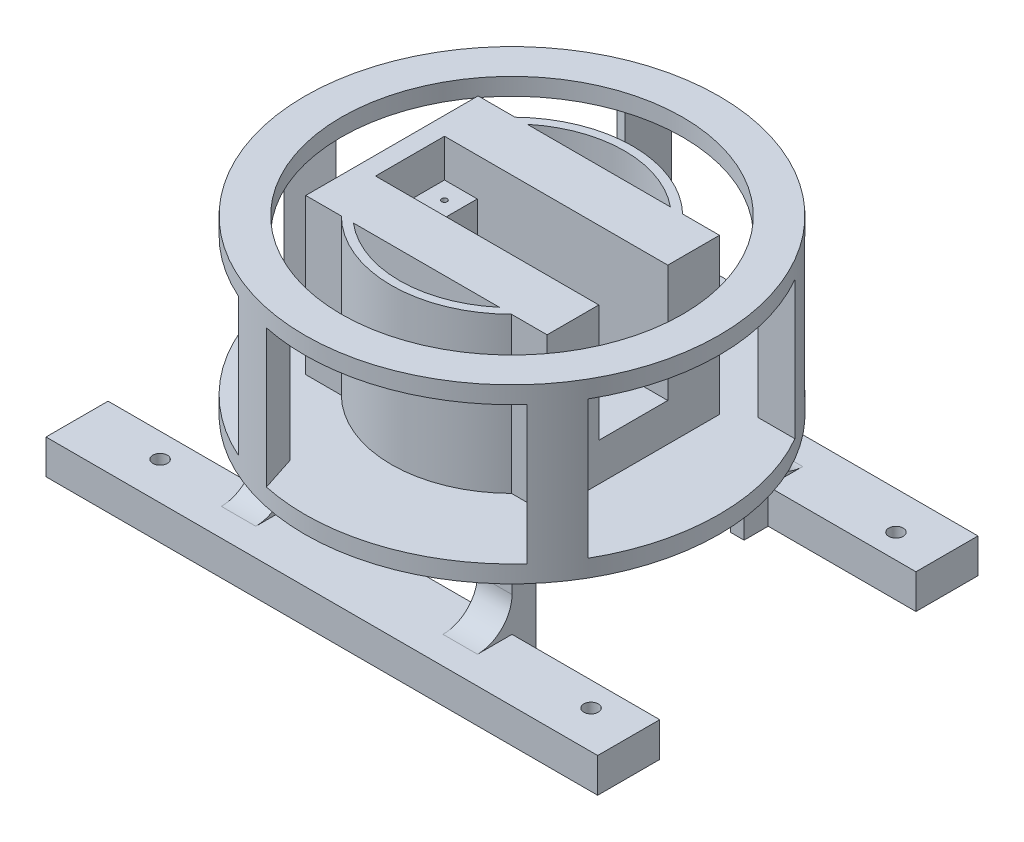
from build123d import *

# Parameters (mm, degrees)
ESQUISSE1_W                  = 70
ESQUISSE1_H                  = 50
BOSS_EXTRU_1_DEPTH           = 50
ESQUISSE2_W                  = 40.5
ESQUISSE2_H                  = 20
ENL_V_MAT_EXTRU_1_DEPTH      = 38
ESQUISSE3_W                  = 9.502474521
ESQUISSE3_H                  = 20
ENL_V_MAT_EXTRU_2_DEPTH      = 11
ESQUISSE4_R                  = 60.076490873
ESQUISSE4_R_2                = 49.5
BOSS_EXTRU_2_DEPTH           = 50
ESQUISSE5_W                  = 60
ESQUISSE5_H                  = 40
ENL_V_MAT_EXTRU_3_DEPTH      = 24
R_P_TITION_START             = -20
R_P_TITION_CIRCULAIRE1_DEPTH = 40
ESQUISSE12_W                 = 74.3
ESQUISSE12_H                 = 74.3
BOSS_EXTRU_7_DEPTH           = 28
ESQUISSE13_W                 = 160
ESQUISSE13_H                 = 18
BOSS_EXTRU_8_DEPTH           = 10
ESQUISSE15_R                 = 60.076490873
BOSS_EXTRU_9_DEPTH           = 5
ESQUISSE16_W                 = 60
ESQUISSE16_H                 = 70
ENL_V_MAT_EXTRU_4_DEPTH      = 28
ENL_V_MAT_EXTRU_5_REACH      = 156.276
ESQUISSE17_W                 = 60.3
ESQUISSE17_H                 = 28
ENL_V_MAT_EXTRU_6_REACH      = 138.609
ESQUISSE18_W                 = 54.3
ESQUISSE18_H                 = 15.510808694
TROU_TARAUD_M5X0_82_D        = 4.2
TROU_TARAUD_M5X0_82_DEPTH    = 54.927
TROU_TARAUD_M5X0_82_TIP      = 1.2618073
TROU_TARAUD_M5X0_83_D        = 4.2
TROU_TARAUD_M5X0_83_DEPTH    = 54.927
TROU_TARAUD_M5X0_83_TIP      = 1.2618073
CONG_1_R                     = 10
ESQUISSE25_W                 = 16.470730929
ESQUISSE25_H                 = 20
ENL_V_MAT_EXTRU_7_DEPTH      = 34
TROU_TARAUD_M2X0_41_D        = 1.6
TROU_TARAUD_M2X0_41_DEPTH    = 15
TROU_TARAUD_M2X0_41_TIP      = 0.480688495


# Read off the part's stored shape, not the designer's step: Répétition circulaire1
with BuildPart() as part:
    # Esquisse1 → Boss.-Extru.1 (new body)
    with BuildSketch(Plane.XY):
        Rectangle(ESQUISSE1_W, ESQUISSE1_H)
    extrude(amount=BOSS_EXTRU_1_DEPTH)

    # Esquisse2 → Enlèv. mat.-Extru.1 (cut)
    with BuildSketch(Plane(origin=(0, 25, 0), x_dir=(1, 0, 0), z_dir=(0, 1, 0))):
        with Locations((0, -25)):
            Rectangle(ESQUISSE2_W, ESQUISSE2_H)
    extrude(amount=-ENL_V_MAT_EXTRU_1_DEPTH, mode=Mode.SUBTRACT)

    # Esquisse3 → Enlèv. mat.-Extru.2 (cut)
    with BuildSketch(Plane(origin=(0, 25, 0), x_dir=(1, 0, 0), z_dir=(0, 1, 0))):
        with Locations((25.001237261, -25)):
            Rectangle(ESQUISSE3_W, ESQUISSE3_H)
        with Locations((-25.001237261, -25)):
            Rectangle(ESQUISSE3_W, ESQUISSE3_H)
    extrude(amount=-ENL_V_MAT_EXTRU_2_DEPTH, mode=Mode.SUBTRACT)

    # Esquisse4 → Boss.-Extru.2 (add)
    # profile 1 of 7: a face of its own
    with BuildSketch(Plane(origin=(0, 25, 0), x_dir=(1, 0, 0), z_dir=(0, 1, 0))):
        with Locations(Location((0, -25.176679726, 0), (0, 0, 270))):
            Circle(ESQUISSE4_R)
        with Locations(Location((0, -25.176679726, 0), (0, 0, 270))):
            Circle(ESQUISSE4_R_2, mode=Mode.SUBTRACT)
    # profile 2 of 7: a face of its own
    with BuildSketch(Plane(origin=(0, 25, 0), x_dir=(1, 0, 0), z_dir=(0, 1, 0))):
        with BuildLine():
            ThreePointArc((24.673928965, -50), (32.315534297, -38.619381951), (35, -25.176679726))
            ThreePointArc((35, -25.176679726), (32.217729855, -11.501231543), (24.313263828, 0))
            Line((24.313263828, 0), (20.744399349, 0))
            ThreePointArc((20.744399349, 0), (29.503552635, -11.257782921), (32.622006474, -25.176679726))
            ThreePointArc((32.622006474, -25.176679726), (29.619854452, -38.846336948), (21.16596506, -50))
            Line((21.16596506, -50), (24.673928965, -50))
        make_face()
    # profile 3 of 7: a face of its own
    with BuildSketch(Plane(origin=(0, 25, 0), x_dir=(1, 0, 0), z_dir=(0, 1, 0))):
        with BuildLine():
            Line((-20.744399349, 0), (-24.313263828, 0))
            ThreePointArc((-24.313263828, 0), (-34.99908948, -24.924220698), (-24.673928965, -50))
            Line((-24.673928965, -50), (-21.16596506, -50))
            ThreePointArc((-21.16596506, -50), (-32.620847034, -24.901643114), (-20.744399349, 0))
        make_face()
    # profile 4 of 7: a face of its own
    with BuildSketch(Plane(origin=(0, 25, 0), x_dir=(1, 0, 0), z_dir=(0, 1, 0))):
        with BuildLine():
            Line((20.744399349, 0), (24.313263828, 0))
            ThreePointArc((24.313263828, 0), (0, 9.823320274), (-24.313263828, 0))
            Line((-24.313263828, 0), (-20.744399349, 0))
            ThreePointArc((-20.744399349, 0), (0, 7.445326748), (20.744399349, 0))
        make_face()
    # profile 5 of 7: a face of its own
    with BuildSketch(Plane(origin=(0, 25, 0), x_dir=(1, 0, 0), z_dir=(0, 1, 0))):
        with BuildLine():
            ThreePointArc((24.673928965, -50), (32.315534297, -38.619381951), (35, -25.176679726))
            ThreePointArc((35, -25.176679726), (32.217729855, -11.501231543), (24.313263828, 0))
            Line((24.313263828, 0), (20.744399349, 0))
            ThreePointArc((20.744399349, 0), (29.503552635, -11.257782921), (32.622006474, -25.176679726))
            ThreePointArc((32.622006474, -25.176679726), (29.619854452, -38.846336948), (21.16596506, -50))
            Line((21.16596506, -50), (24.673928965, -50))
        make_face()
    # profile 6 of 7: a face of its own
    with BuildSketch(Plane(origin=(0, 25, 0), x_dir=(1, 0, 0), z_dir=(0, 1, 0))):
        with BuildLine():
            Line((-20.744399349, 0), (-24.313263828, 0))
            ThreePointArc((-24.313263828, 0), (-34.99908948, -24.924220698), (-24.673928965, -50))
            Line((-24.673928965, -50), (-21.16596506, -50))
            ThreePointArc((-21.16596506, -50), (-32.620847034, -24.901643114), (-20.744399349, 0))
        make_face()
    # profile 7 of 7: a face of its own
    with BuildSketch(Plane(origin=(0, 25, 0), x_dir=(1, 0, 0), z_dir=(0, 1, 0))):
        with BuildLine():
            ThreePointArc((-24.673928965, -50), (0, -60.176679726), (24.673928965, -50))
            Line((24.673928965, -50), (21.16596506, -50))
            ThreePointArc((21.16596506, -50), (0, -57.798686199), (-21.16596506, -50))
            Line((-21.16596506, -50), (-24.673928965, -50))
        make_face()
    extrude(amount=-BOSS_EXTRU_2_DEPTH)


with BuildPart() as boss_extru_2_piece_1:
    # of the separate pieces the step leaves, piece 1, a body of its own (boss_extru_2_pieces)
    add(part.part.solids().sort_by_distance((0, 25, 85.253170599))[0])

    # Esquisse5 → Enlèv. mat.-Extru.3 (cut)
    with BuildSketch(Plane(origin=(60.076490873, 0, 0), x_dir=(0, 0, -1), z_dir=(1, 0, 0))):
        with Locations((-25.176679726, 0)):
            Rectangle(ESQUISSE5_W, ESQUISSE5_H)
    extrude(amount=-ENL_V_MAT_EXTRU_3_DEPTH, mode=Mode.SUBTRACT)

    # Répétition circulaire1 outline → Répétition circulaire1 (cut)
    with BuildSketch(Plane(origin=(0, 0, 0), x_dir=(1, 0, 0), z_dir=(0, 1, 0)).offset(R_P_TITION_START)):
        with BuildLine():
            Line((39.373214245, 4.823320274), (41.291457614, 4.823320274))
            Line((41.291457614, 4.823320274), (44.615977372, 15.055140003))
            ThreePointArc((44.615977372, 15.055140003), (18.564656642, 31.959458395), (-12.447413605, 33.596159666))
            Line((-12.447413605, 33.596159666), (-15.771933364, 23.364339937))
            Line((-15.771933364, 23.364339937), (-24.475639087, 29.687952296))
            ThreePointArc((-24.475639087, 29.687952296), (-48.602902078, 10.135395619), (-59.742754225, -18.853067366))
            Line((-59.742754225, -18.853067366), (-51.039048501, -25.176679726))
            Line((-51.039048501, -25.176679726), (-59.742754225, -31.500292085))
            ThreePointArc((-59.742754225, -31.500292085), (-48.602902079, -60.488755071), (-24.475639087, -80.041311748))
            Line((-24.475639087, -80.041311748), (-15.771933364, -73.717699388))
            Line((-15.771933364, -73.717699388), (-12.447413605, -83.949519118))
            ThreePointArc((-12.447413605, -83.949519118), (18.564656643, -82.312817847), (44.615977373, -65.408499455))
            Line((44.615977373, -65.408499455), (41.291457614, -55.176679726))
            Line((41.291457614, -55.176679726), (39.373214245, -55.176679726))
            ThreePointArc((39.373214245, -55.176679726), (-49.5, -25.176679726), (39.373214245, 4.823320274))
        make_face()
    extrude(amount=R_P_TITION_CIRCULAIRE1_DEPTH, mode=Mode.SUBTRACT)



with BuildPart() as boss_extru_2_piece_2:
    # of the separate pieces the step leaves, piece 2, a body of its own (boss_extru_2_pieces)
    add(part.part.solids().sort_by_distance((-35, 25, 0))[0])


with BuildPart() as boss_extru_2_piece_1_1:
    add(boss_extru_2_piece_1.part)

    add(boss_extru_2_piece_2.part)  # Boss.-Extru.7 merges Boss.-Extru.2 piece 2
    # Esquisse12 → Boss.-Extru.7 (add)
    with BuildSketch(Plane.XZ.offset(25)):
        with Locations((0, 25.176679726)):
            Rectangle(ESQUISSE12_W, ESQUISSE12_H)
    extrude(amount=BOSS_EXTRU_7_DEPTH)

    # Esquisse13 → Boss.-Extru.8 (add)
    with BuildSketch(Plane.XZ.offset(53)):
        with Locations((0, 71.326679726)):
            Rectangle(ESQUISSE13_W, ESQUISSE13_H)
        with Locations((0, -20.973320274)):
            Rectangle(ESQUISSE13_W, ESQUISSE13_H)
    extrude(amount=-BOSS_EXTRU_8_DEPTH)

    # Esquisse15 → Boss.-Extru.9 (add)
    with BuildSketch(Plane(origin=(0, -20, 0), x_dir=(1, 0, 0), z_dir=(0, 1, 0))):
        with Locations(Location((0, -25.176679726, 0), (0, 0, 270))):
            Circle(ESQUISSE15_R)
    extrude(amount=-BOSS_EXTRU_9_DEPTH)

    # Esquisse16 → Enlèv. mat.-Extru.4 (cut)
    with BuildSketch(Plane.XZ.offset(53)):
        with Locations((3.15, 25.176679726)):
            Rectangle(ESQUISSE16_W, ESQUISSE16_H)
    extrude(amount=-ENL_V_MAT_EXTRU_4_DEPTH, mode=Mode.SUBTRACT)

    # Enlèv. mat.-Extru.5: up to this face of the body (flat: up to its plane)
    enl_v_mat_extru_5_end = Plane(boss_extru_2_piece_1_1.part.faces().sort_by_distance((-37.15, -39, 25.176679726))[0])
    # Esquisse17 → Enlèv. mat.-Extru.5 (cut, up to the picked face)
    with BuildSketch(Plane(origin=(37.15, 0, 0), x_dir=(0, 0, -1), z_dir=(1, 0, 0)), mode=Mode.PRIVATE) as enl_v_mat_extru_5_sk1:
        with Locations((-25.176679726, -39)):
            Rectangle(ESQUISSE17_W, ESQUISSE17_H)
    enl_v_mat_extru_5_tool1 = split(extrude(enl_v_mat_extru_5_sk1.sketch, amount=-ENL_V_MAT_EXTRU_5_REACH, mode=Mode.PRIVATE), bisect_by=enl_v_mat_extru_5_end, keep=Keep.BOTH, mode=Mode.PRIVATE)
    add(enl_v_mat_extru_5_tool1.solids().sort_by(Axis((37.15, -39, 25.17668), (-1, 0, 0)))[0], mode=Mode.SUBTRACT)

    # Enlèv. mat.-Extru.6: up to this face of the body (flat: up to its plane)
    enl_v_mat_extru_6_end = Plane(boss_extru_2_piece_1_1.part.faces().sort_by_distance((0, -34, -11.973320274))[0])
    # Esquisse18 → Enlèv. mat.-Extru.6 (cut, up to the picked face)
    with BuildSketch(Plane.XY.offset(62.326679726), mode=Mode.PRIVATE) as enl_v_mat_extru_6_sk1:
        with Locations((0, -35.244595653)):
            Rectangle(ESQUISSE18_W, ESQUISSE18_H)
    enl_v_mat_extru_6_tool1 = split(extrude(enl_v_mat_extru_6_sk1.sketch, amount=-ENL_V_MAT_EXTRU_6_REACH, mode=Mode.PRIVATE), bisect_by=enl_v_mat_extru_6_end, keep=Keep.BOTH, mode=Mode.PRIVATE)
    add(enl_v_mat_extru_6_tool1.solids().sort_by(Axis((0, -35.244596, 62.32668), (0, 0, -1)))[0], mode=Mode.SUBTRACT)

    # Trou taraudé M5x0.82
    with Locations(Plane(origin=(-57.931903984, -53, -18.999181229), x_dir=(0, 0, -1), z_dir=(0, -1, 0))):
        with Locations((0, 0), (-88.38422, 0.087735642)):
            Hole(TROU_TARAUD_M5X0_82_D / 2, depth=TROU_TARAUD_M5X0_82_DEPTH)
            with Locations((0, 0, -(TROU_TARAUD_M5X0_82_DEPTH + TROU_TARAUD_M5X0_82_TIP / 2))):  # 118° drill point
                Cone(0, TROU_TARAUD_M5X0_82_D / 2, TROU_TARAUD_M5X0_82_TIP, mode=Mode.SUBTRACT)

    # Trou taraudé M5x0.83
    with Locations(Plane(origin=(67.121659864, -53, 69.376817601), x_dir=(0, 0, -1), z_dir=(0, -1, 0))):
        with Locations((0, 0), (88.384296015, 0.049521474)):
            Hole(TROU_TARAUD_M5X0_83_D / 2, depth=TROU_TARAUD_M5X0_83_DEPTH)
            with Locations((0, 0, -(TROU_TARAUD_M5X0_83_DEPTH + TROU_TARAUD_M5X0_83_TIP / 2))):  # 118° drill point
                Cone(0, TROU_TARAUD_M5X0_83_D / 2, TROU_TARAUD_M5X0_83_TIP, mode=Mode.SUBTRACT)

    # Congé1
    cong_1_edges = [boss_extru_2_piece_1_1.edges().sort_by_distance(p)[0] for p in [
        (-32.15, -43, 62.326679726),
        (32.15, -43, -11.973320274),
        (32.15, -43, 62.326679726),
        (-32.15, -43, -11.973320274),
    ]]
    fillet(cong_1_edges, radius=CONG_1_R)

    # Esquisse25 → Enlèv. mat.-Extru.7 (cut)
    with BuildSketch(Plane(origin=(0, 25, 0), x_dir=(1, 0, 0), z_dir=(0, 1, 0))):
        with Locations((26.764634536, -25)):
            Rectangle(ESQUISSE25_W, ESQUISSE25_H)
    extrude(amount=-ENL_V_MAT_EXTRU_7_DEPTH, mode=Mode.SUBTRACT)

    # Trou taraudé M2x0.41
    with Locations(Plane(origin=(-24.71, 14, 20.075), x_dir=(0, 0, 1), z_dir=(0, 1, 0))):
        with Locations((0, 0), (9.85, 0)):
            Hole(TROU_TARAUD_M2X0_41_D / 2, depth=TROU_TARAUD_M2X0_41_DEPTH)
            with Locations((0, 0, -(TROU_TARAUD_M2X0_41_DEPTH + TROU_TARAUD_M2X0_41_TIP / 2))):  # 118° drill point
                Cone(0, TROU_TARAUD_M2X0_41_D / 2, TROU_TARAUD_M2X0_41_TIP, mode=Mode.SUBTRACT)


solid = boss_extru_2_piece_1_1.part
